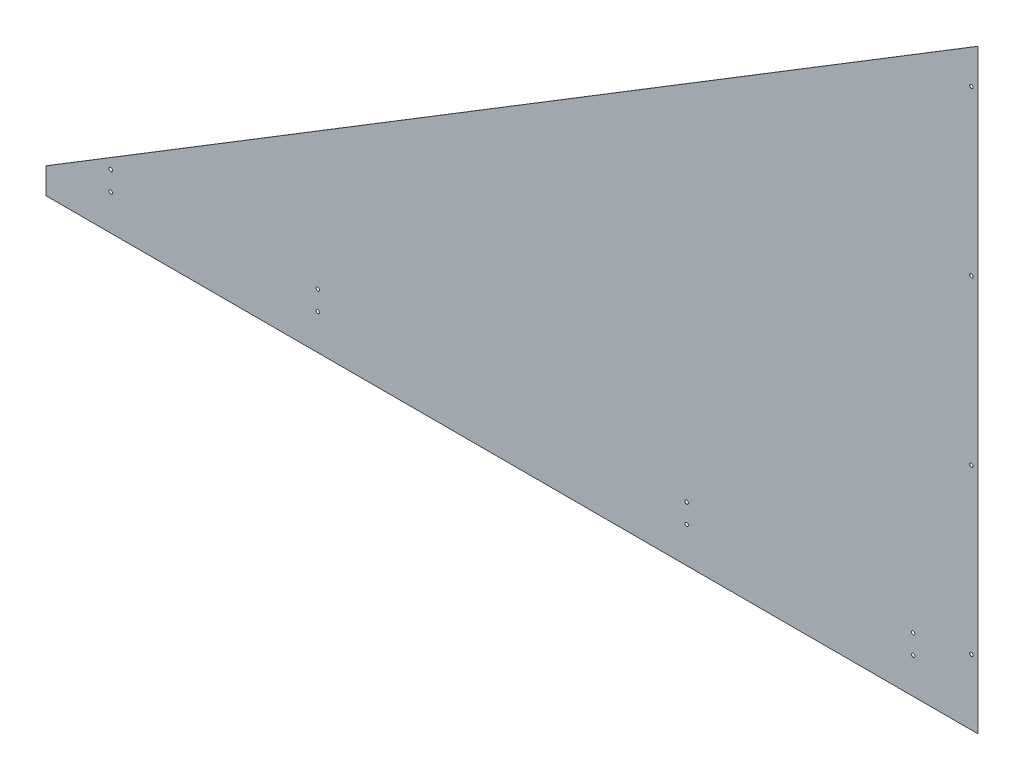
from build123d import *

# Parameters (mm, degrees)
GE_20327_OUTLINE_R = 3.3782
GE_20327_DEPTH     = 3.175
SKETCH3_W          = 2.921
SKETCH3_H          = 1168.4
CUT_EXTRUDE1_DEPTH = 2144.256699657


# Read off the part's stored shape, not the designer's step: GE-20327
with BuildPart() as part:
    # GE-20327 outline → GE-20327 (new body)
    with BuildSketch(Plane.XY):
        Polygon((1828.8, -50.8), (1828.8, 1117.6), (0, 0), (0, -50.8), align=None)
        with Locations((127, 19.05)):
            Circle(GE_20327_OUTLINE_R, mode=Mode.SUBTRACT)
        with Locations((127, 57.15)):
            Circle(GE_20327_OUTLINE_R, mode=Mode.SUBTRACT)
        with Locations((533.4, 19.05)):
            Circle(GE_20327_OUTLINE_R, mode=Mode.SUBTRACT)
        with Locations((533.4, 57.15)):
            Circle(GE_20327_OUTLINE_R, mode=Mode.SUBTRACT)
        with Locations((1257.3, 19.05)):
            Circle(GE_20327_OUTLINE_R, mode=Mode.SUBTRACT)
        with Locations((1257.3, 57.15)):
            Circle(GE_20327_OUTLINE_R, mode=Mode.SUBTRACT)
        with Locations((1701.8, 19.05)):
            Circle(GE_20327_OUTLINE_R, mode=Mode.SUBTRACT)
        with Locations((1701.8, 57.15)):
            Circle(GE_20327_OUTLINE_R, mode=Mode.SUBTRACT)
        with Locations((1816.1, 77.7875)):
            Circle(GE_20327_OUTLINE_R, mode=Mode.SUBTRACT)
        with Locations((1816.1, 399.520833333)):
            Circle(GE_20327_OUTLINE_R, mode=Mode.SUBTRACT)
        with Locations((1816.1, 721.254166667)):
            Circle(GE_20327_OUTLINE_R, mode=Mode.SUBTRACT)
        with Locations((1816.1, 1042.9875)):
            Circle(GE_20327_OUTLINE_R, mode=Mode.SUBTRACT)
    extrude(amount=GE_20327_DEPTH)

    # Sketch3 → Cut-Extrude1 (cut, through all)
    with BuildSketch(Plane(origin=(1828.8, 0, 0), x_dir=(0, 0, -1), z_dir=(1, 0, 0))):
        with Locations((-1.7145, 533.4)):
            Rectangle(SKETCH3_W, SKETCH3_H)
    extrude(amount=-CUT_EXTRUDE1_DEPTH, mode=Mode.SUBTRACT)


solid = part.part
